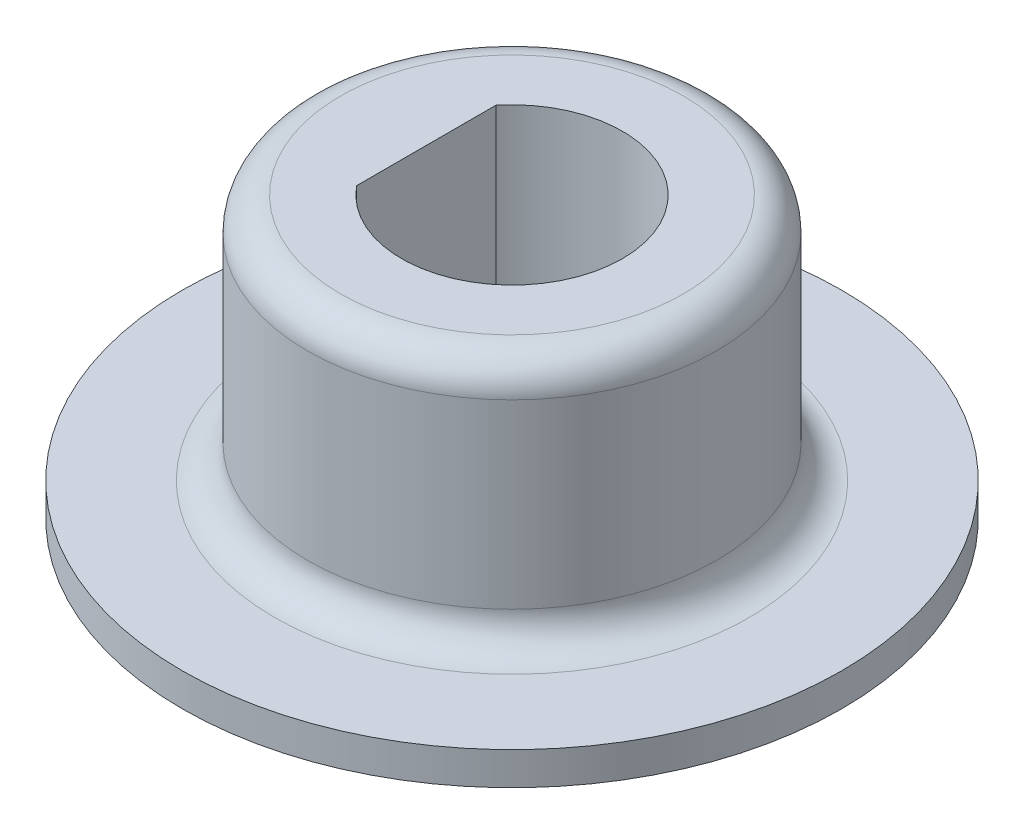
from build123d import *

# Parameters (mm, degrees)
CUT_EXTRUDE1_DEPTH = 10
FILLET1_R          = 1


with BuildPart() as part:
    # Sketch2 → Revolve1 (revolve)
    with BuildSketch(Plane.XY):
        Polygon((0, 0), (0, 8.5), (-6.2, 8.5), (-6.2, 1), (-10, 1), (-10, 0), align=None)
    revolve(axis=Axis((0, 0, 0), (0, 1, 0)))

    # Sketch3 → Cut-Extrude1 (cut)
    with BuildSketch(Plane(origin=(0, 8.5, 0), x_dir=(1, 0, 0), z_dir=(0, 1, 0))):
        with BuildLine():
            Line((-2.6, 2.112463017), (-2.6, -2.112463017))
            ThreePointArc((-2.6, -2.112463017), (3.35, 0), (-2.6, 2.112463017))
        make_face()
    extrude(amount=-CUT_EXTRUDE1_DEPTH, mode=Mode.SUBTRACT)

    # Fillet1
    fillet1_edges = [part.edges().sort_by_distance(p)[0] for p in [
        (6.2, 1, 0),
        (6.2, 8.5, 0),
    ]]
    fillet(fillet1_edges, radius=FILLET1_R)


solid = part.part
